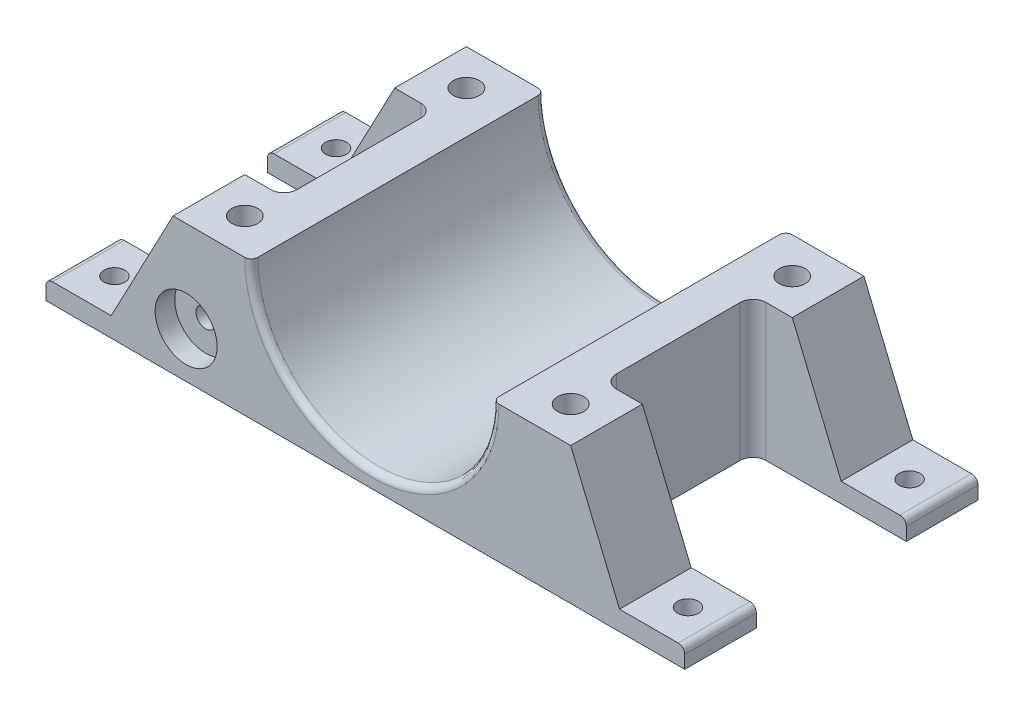
from build123d import *

# Parameters (mm, degrees)
BOSS_EXTRUDE1_DEPTH     = 22.5
SKETCH2_W               = 25.5
SKETCH2_H               = 23
SKETCH2_W_2             = 23.5
CUT_EXTRUDE1_DEPTH      = 65
SKETCH3_R               = 1.6
CUT_EXTRUDE2_DEPTH      = 65
SKETCH4_R               = 4.75
BEARING_HOLE_DEPTH      = 3
CUT_EXTRUDE4_DEPTH      = 69.593002559
CUT_EXTRUDE4_DEPTH_BACK = 69.593002559
SKETCH5_R               = 1.5
FILLET2_R               = 1
FILLET3_R               = 2
CUT_EXTRUDE5_DEPTH      = 59.713286401
CUT_EXTRUDE5_DEPTH_BACK = 10
SKETCH6_R               = 2


with BuildPart() as part:
    # Sketch1 → Boss-Extrude1 (new, symmetric)
    with BuildSketch(Plane.XY):
        with BuildLine():
            Line((-18.5, 0), (-30.5, 0))
            Line((-30.5, 0), (-40, -18))
            Line((-40, -18), (-50, -18))
            Line((-50, -18), (-50, -21))
            Line((-50, -21), (0, -21))
            Line((0, -21), (48, -21))
            Line((48, -21), (48, -18))
            Line((48, -18), (38, -18))
            Line((38, -18), (30.5, 0))
            Line((30.5, 0), (18.5, 0))
            ThreePointArc((18.5, 0), (0, -18.5), (-18.5, 0))
        make_face()
    extrude(amount=BOSS_EXTRUDE1_DEPTH, both=True)

    # Sketch2 → Cut-Extrude1 (cut)
    with BuildSketch(Plane(origin=(0, 0, 0), x_dir=(1, 0, 0), z_dir=(0, 1, 0))):
        with Locations((-37.25, 0)):
            Rectangle(SKETCH2_W, SKETCH2_H)
        with Locations((36.25, 0)):
            Rectangle(SKETCH2_W_2, SKETCH2_H)
    extrude(amount=-CUT_EXTRUDE1_DEPTH, mode=Mode.SUBTRACT)

    # Sketch3 → Cut-Extrude2 (cut)
    with BuildSketch(Plane(origin=(0, -18, 0), x_dir=(1, 0, 0), z_dir=(0, 1, 0))):
        with Locations((-45, 17)):
            Circle(SKETCH3_R)
        with Locations((43, 17)):
            Circle(SKETCH3_R)
        with Locations((43, -17)):
            Circle(SKETCH3_R)
        with Locations((-45, -17)):
            Circle(SKETCH3_R)
    extrude(amount=-CUT_EXTRUDE2_DEPTH, mode=Mode.SUBTRACT)

    # Sketch4 → Bearing-Hole (cut)
    with BuildSketch(Plane.XY.offset(22.5)):
        with Locations((-28.5, -14)):
            Circle(SKETCH4_R)
    bearing_hole = extrude(amount=-BEARING_HOLE_DEPTH, mode=Mode.SUBTRACT)

    # Mirror1: Bearing-Hole across plane
    add(bearing_hole.mirror(Plane.XY), mode=Mode.SUBTRACT)

    # Sketch5 → Cut-Extrude4 (cut, two sides: drawn at the far end of the back side and taken through both)
    with BuildSketch(Plane.XY.offset(19.5).offset(-CUT_EXTRUDE4_DEPTH_BACK)):
        with Locations((-28.5, -14)):
            Circle(SKETCH5_R)
    extrude(amount=CUT_EXTRUDE4_DEPTH + CUT_EXTRUDE4_DEPTH_BACK, mode=Mode.SUBTRACT)

    # Fillet2
    fillet2_edges = [part.edges().sort_by_distance(p)[0] for p in [
        (0, -18.5, -22.5),
        (0, -18.5, 22.5),
        (48, -18, -17),
        (48, -18, 17),
        (-50, -18, -17),
        (-50, -18, 17),
    ]]
    fillet(fillet2_edges, radius=FILLET2_R)

    # Fillet3
    fillet3_edges = [part.edges().sort_by_distance(p)[0] for p in [
        (24.5, -10.5, -11.5),
        (24.5, -10.5, 11.5),
        (-24.5, -10.5, 11.5),
        (-24.5, -10.5, -11.5),
    ]]
    fillet(fillet3_edges, radius=FILLET3_R)

    # Sketch6 → Cut-Extrude5 (cut, two sides: drawn at the far end of the back side and taken through both)
    with BuildSketch(Plane(origin=(0, 0, 0), x_dir=(1, 0, 0), z_dir=(0, 1, 0)).offset(-CUT_EXTRUDE5_DEPTH_BACK)):
        with Locations((-25, 17)):
            Circle(SKETCH6_R)
        with Locations((25, 17)):
            Circle(SKETCH6_R)
        with Locations((25, -17)):
            Circle(SKETCH6_R)
        with Locations((-25, -17)):
            Circle(SKETCH6_R)
    extrude(amount=CUT_EXTRUDE5_DEPTH + CUT_EXTRUDE5_DEPTH_BACK, mode=Mode.SUBTRACT)


solid = part.part
